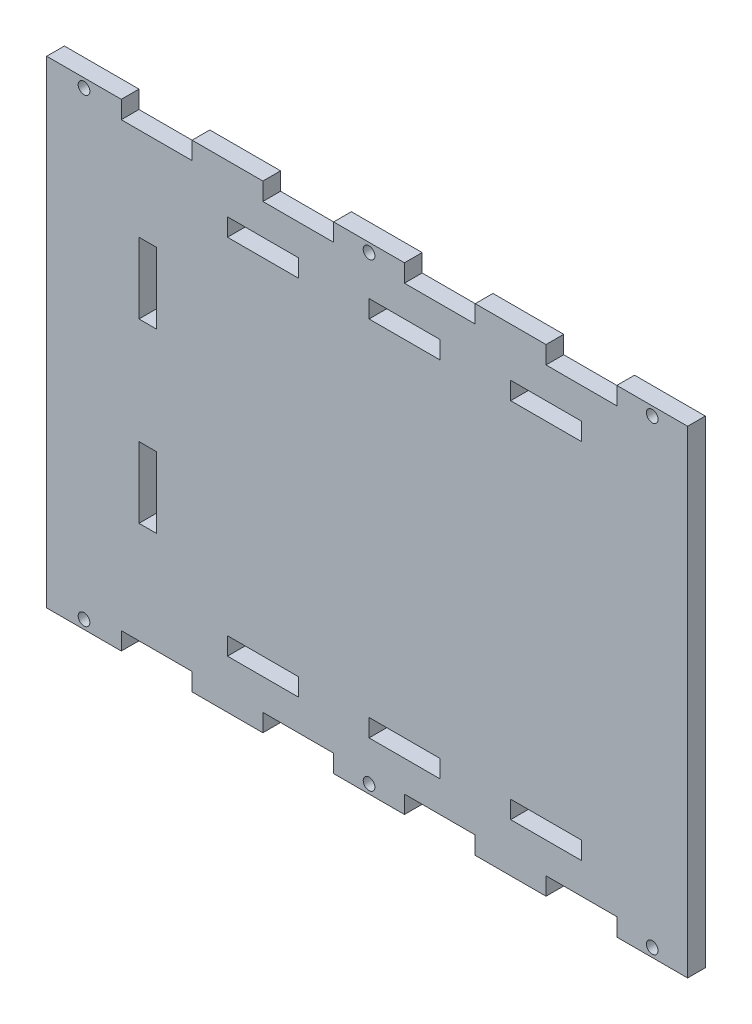
from build123d import *

# Parameters (mm, degrees)
SKETCH1_W           = 229.969358589
SKETCH1_H           = 171.45
BOSS_EXTRUDE1_DEPTH = 6.35
SKETCH2_W           = 25.4
SKETCH2_H           = 6.35
CUT_EXTRUDE1_DEPTH  = 6.35
LPATTERN1_COUNT     = 4
LPATTERN1_PITCH     = 50.8
SKETCH4_R           = 2.0955
CUT_EXTRUDE2_DEPTH  = 209.955242778
SKETCH5_W           = 25.4
SKETCH5_H           = 6.35
SKETCH5_W_2         = 6.35
SKETCH5_H_2         = 25.4
CUT_EXTRUDE3_DEPTH  = 6.35


with BuildPart() as part:
    # Sketch1 → Boss-Extrude1 (new body)
    with BuildSketch(Plane.XY):
        with Locations((-24.365205383, 69.85)):
            Rectangle(SKETCH1_W, SKETCH1_H)
    extrude(amount=BOSS_EXTRUDE1_DEPTH)

    # Sketch2 → Cut-Extrude1 (cut)
    with BuildSketch(Plane.XY.offset(6.35)):
        with Locations((-99.880526088, -12.7)):
            Rectangle(SKETCH2_W, SKETCH2_H)
        with Locations((-99.880526088, 152.4)):
            Rectangle(SKETCH2_W, SKETCH2_H)
    cut_extrude1 = extrude(amount=-CUT_EXTRUDE1_DEPTH, mode=Mode.SUBTRACT)

    # LPattern1: Cut-Extrude1 ×4
    with Locations(*[(i * LPATTERN1_PITCH, 0, 0) for i in range(1, LPATTERN1_COUNT)]):
        add(cut_extrude1, mode=Mode.SUBTRACT)

    # Sketch4 → Cut-Extrude2 (cut, through all)
    with BuildSketch(Plane(origin=(0, 0, 0), x_dir=(-1, 0, 0), z_dir=(0, 0, -1))):
        with Locations((-77.919473912, -12.7)):
            Circle(SKETCH4_R)
        with Locations((23.680526088, -12.7)):
            Circle(SKETCH4_R)
        with Locations((125.965205383, -12.7)):
            Circle(SKETCH4_R)
        with Locations((125.965205383, 152.4)):
            Circle(SKETCH4_R)
        with Locations((23.680526088, 152.4)):
            Circle(SKETCH4_R)
        with Locations((-77.919473912, 152.4)):
            Circle(SKETCH4_R)
    extrude(amount=-CUT_EXTRUDE2_DEPTH, mode=Mode.SUBTRACT)

    # Sketch5 → Cut-Extrude3 (cut)
    with BuildSketch(Plane(origin=(0, 0, 0), x_dir=(-1, 0, 0), z_dir=(0, 0, -1))):
        with Locations((-39.819473912, 4.7625)):
            Rectangle(SKETCH5_W, SKETCH5_H)
        with Locations((10.980526088, 4.7625)):
            Rectangle(SKETCH5_W, SKETCH5_H)
        with Locations((61.780526088, 4.7625)):
            Rectangle(SKETCH5_W, SKETCH5_H)
        with Locations((103.055526088, 39.6875)):
            Rectangle(SKETCH5_W_2, SKETCH5_H_2)
        with Locations((103.055526088, 103.1875)):
            Rectangle(SKETCH5_W_2, SKETCH5_H_2)
        with Locations((61.780526088, 134.9375)):
            Rectangle(SKETCH5_W, SKETCH5_H)
        with Locations((10.980526088, 134.9375)):
            Rectangle(SKETCH5_W, SKETCH5_H)
        with Locations((-39.819473912, 134.9375)):
            Rectangle(SKETCH5_W, SKETCH5_H)
    extrude(amount=-CUT_EXTRUDE3_DEPTH, mode=Mode.SUBTRACT)


solid = part.part
